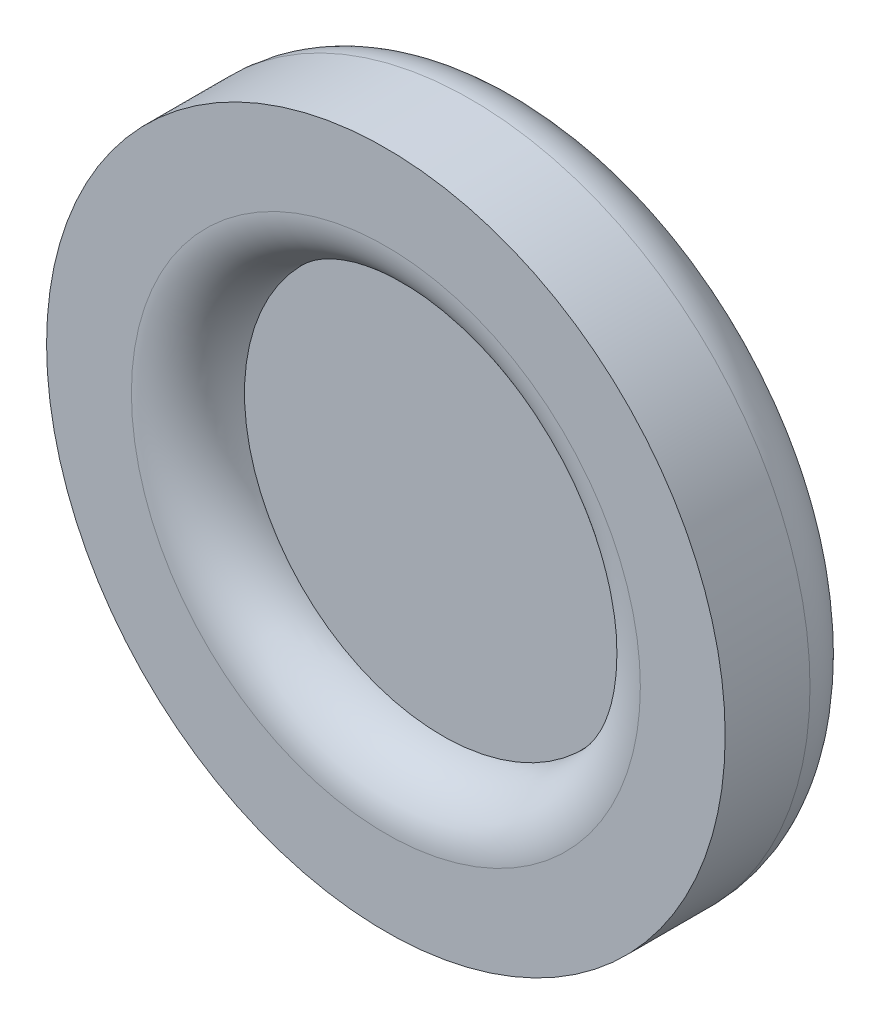
from build123d import *

# Parameters (mm, degrees)
IZIM1_R                     = 6
Y_KSEKLIK_EKSTR_ZYON1_DEPTH = 2.5
IZIM2_R                     = 3.5
KES_EKSTR_ZYON1_DEPTH       = 1
RADYUS1_R                   = 1
KES_EKSTR_ZYON2_DEPTH       = 0.75


with BuildPart() as part:
    # Çizim1 → Yükseklik-Ekstrüzyon1 (new body)
    with BuildSketch(Plane.XY):
        Circle(IZIM1_R)
    extrude(amount=Y_KSEKLIK_EKSTR_ZYON1_DEPTH)

    # Çizim2 → Kes-Ekstrüzyon1 (cut)
    with BuildSketch(Plane.XY.offset(2.5)):
        Circle(IZIM2_R)
    extrude(amount=-KES_EKSTR_ZYON1_DEPTH, mode=Mode.SUBTRACT)

    # Radyus1
    radyus1_edges = [part.edges().sort_by_distance(p)[0] for p in [
        (-6, 0, 0),
        (-3.5, 0, 2.5),
    ]]
    fillet(radyus1_edges, radius=RADYUS1_R - 0.0001)  # a hair under: the kernel refuses the full size

    # Çizim3 → Kes-Ekstrüzyon2 (cut)
    # profile 1 of 2: a face of its own
    with BuildSketch(Plane(origin=(0, 0, 0), x_dir=(-1, 0, 0), z_dir=(0, 0, -1))):
        with BuildLine():
            Line((-0.929795565, 1.3003359), (-0.683801975, 1.724214105))
            Line((-0.683801975, 1.724214105), (-0.47867377, 1.724214105))
            Line((-0.47867377, 1.724214105), (-0.47867377, 0.237034617))
            Line((-0.47867377, 0.237034617), (-0.735084027, 0.237034617))
            add(Edge.make_bspline(
                [(-0.735084027, 0.237034617), (-0.75064047, 0.286868347), (-0.781084267, 0.384392431), (-0.83356691, 0.524628794), (-0.892501203, 0.654530813), (-0.954686735, 0.775310751), (-1.022125573, 0.886178457), (-1.094152837, 0.987888941), (-1.172125049, 1.079103644), (-1.253846206, 1.16142683), (-1.339674566, 1.233044675), (-1.426952438, 1.296443905), (-1.51753898, 1.348502365), (-1.609775187, 1.392281334), (-1.704584729, 1.425953753), (-1.801421863, 1.450148778), (-1.900483194, 1.465087994), (-1.967404279, 1.466894158), (-2.001109668, 1.467803848)],
                knots=[0, 0, 0, 0, 1.319776028, 2.582787814, 3.782699321, 4.924401408, 6.015368239, 7.061002147, 8.071798736, 9.045905284, 9.99008261, 10.895199989, 11.76966991, 12.627609111, 13.473423528, 14.308713002, 15.148168534, 16, 16, 16, 16], degree=3))
            add(Edge.make_bspline(
                [(-2.001109668, 1.467803848), (-2.029438448, 1.467117142), (-2.084900049, 1.46577272), (-2.166265483, 1.457332437), (-2.243343375, 1.440936769), (-2.316505964, 1.419302589), (-2.386196292, 1.392385603), (-2.450967361, 1.35737242), (-2.512504436, 1.317374775), (-2.568686299, 1.270942394), (-2.620189553, 1.220979622), (-2.663919755, 1.166902177), (-2.702320752, 1.111626606), (-2.732919314, 1.053133641), (-2.757251849, 0.992259792), (-2.773647614, 0.92866675), (-2.784878637, 0.862966203), (-2.785864254, 0.818280035), (-2.786366078, 0.795528207)],
                knots=[0, 0, 0, 0, 1.179059863, 2.308343204, 3.398322431, 4.453397569, 5.481306975, 6.500646799, 7.511833234, 8.530869999, 9.529082904, 10.492593709, 11.420571073, 12.32549536, 13.233690467, 14.142293599, 15.054154357, 16, 16, 16, 16], degree=3))
            add(Edge.make_bspline(
                [(-2.786366078, 0.795528207), (-2.785156297, 0.768760973), (-2.782765488, 0.715862692), (-2.767697317, 0.638125981), (-2.74011211, 0.564525819), (-2.704644593, 0.493232386), (-2.655518289, 0.426495541), (-2.593191488, 0.365658888), (-2.51801856, 0.310382821), (-2.446678669, 0.267296128), (-2.379510611, 0.236501681), (-2.319729039, 0.211453404), (-2.251208769, 0.185770195), (-2.173303716, 0.161630379), (-2.087352801, 0.135792209), (-1.992626499, 0.109188541), (-1.88889226, 0.083042119), (-1.81657617, 0.066241372), (-1.779154539, 0.057547438)],
                knots=[0, 0, 0, 0, 0.943059919, 1.863705786, 2.77434775, 3.70417639, 4.66005306, 5.6778557, 6.75972726, 7.940743775, 8.605693911, 9.360472581, 10.223717259, 11.181721083, 12.232383809, 13.385071369, 14.64684479, 16, 16, 16, 16], degree=3))
            add(Edge.make_bspline(
                [(-1.779154539, 0.057547438), (-1.735327786, 0.047228998), (-1.650766921, 0.027320242), (-1.528934937, -0.003037612), (-1.417136907, -0.032862452), (-1.314784257, -0.060366544), (-1.222913181, -0.088874415), (-1.140388893, -0.114822493), (-1.067901847, -0.140347344), (-1.023486316, -0.158378148), (-1.002712232, -0.166811536)],
                knots=[0, 0, 0, 0, 1.335747715, 2.577238166, 3.724662844, 4.768505699, 5.721015054, 6.578035404, 7.334917034, 8, 8, 8, 8], degree=3))
            add(Edge.make_bspline(
                [(-1.002712232, -0.166811536), (-0.973207892, -0.18016647), (-0.9154039, -0.206331044), (-0.832285333, -0.249437538), (-0.755696501, -0.297046843), (-0.683611728, -0.346493816), (-0.618277859, -0.400171008), (-0.558166709, -0.456813452), (-0.503978604, -0.516503392), (-0.455442159, -0.579464937), (-0.412791666, -0.645779091), (-0.374916134, -0.715148419), (-0.343814011, -0.788567774), (-0.31790574, -0.865133471), (-0.298124554, -0.945306708), (-0.283445069, -1.028798756), (-0.275739149, -1.115919538), (-0.274286831, -1.175078313), (-0.273545565, -1.205273075)],
                knots=[0, 0, 0, 0, 1.14653782, 2.246261516, 3.311791084, 4.337468781, 5.33879562, 6.302025459, 7.259342286, 8.189897906, 9.113170072, 10.048231112, 10.984438999, 11.93236922, 12.907088183, 13.905150231, 14.930784337, 16, 16, 16, 16], degree=3))
            add(Edge.make_bspline(
                [(-0.273545565, -1.205273075), (-0.274415116, -1.250218566), (-0.276115481, -1.338107236), (-0.295478092, -1.46605016), (-0.324749983, -1.587301497), (-0.366538713, -1.701611901), (-0.420444766, -1.809016652), (-0.48683347, -1.908624989), (-0.564059436, -2.002372511), (-0.624321236, -2.057205807), (-0.654955821, -2.085080767)],
                knots=[0, 0, 0, 0, 1.087616632, 2.126780161, 3.126105745, 4.104252425, 5.067529187, 6.029110535, 6.998082019, 8, 8, 8, 8], degree=3))
            add(Edge.make_bspline(
                [(-0.654955821, -2.085080767), (-0.693876042, -2.116892376), (-0.771148794, -2.180051588), (-0.897431098, -2.259811493), (-1.029200924, -2.328903852), (-1.168936325, -2.383670286), (-1.314927503, -2.428652875), (-1.468646716, -2.458147081), (-1.628564666, -2.477261058), (-1.737430873, -2.479682889), (-1.792776334, -2.4809141)],
                knots=[0, 0, 0, 0, 0.978964361, 1.943649534, 2.905309704, 3.874955019, 4.86478111, 5.878630743, 6.921537144, 8, 8, 8, 8], degree=3))
            add(Edge.make_bspline(
                [(-1.792776334, -2.4809141), (-1.844386472, -2.479671831), (-1.946601067, -2.477211498), (-2.098204003, -2.457814719), (-2.246807388, -2.428299692), (-2.391275812, -2.383001538), (-2.533060343, -2.328382483), (-2.670402979, -2.25898581), (-2.805776792, -2.17970297), (-2.890800715, -2.116862592), (-2.933801975, -2.085080767)],
                knots=[0, 0, 0, 0, 1.006582518, 1.993550691, 2.977708554, 3.958494488, 4.943590011, 5.938682306, 6.957478621, 8, 8, 8, 8], degree=3))
            Line((-2.933801975, -2.085080767), (-3.247904539, -2.4809141))
            Line((-3.247904539, -2.4809141), (-3.453032744, -2.4809141))
            Line((-3.453032744, -2.4809141), (-3.453032744, -0.993734613))
            Line((-3.453032744, -0.993734613), (-3.196622488, -0.993734613))
            add(Edge.make_bspline(
                [(-3.196622488, -0.993734613), (-3.1819724, -1.043599174), (-3.15336061, -1.140985235), (-3.101798385, -1.280604958), (-3.045079626, -1.410783267), (-2.982593113, -1.53135924), (-2.914450396, -1.642342487), (-2.840687319, -1.743804949), (-2.761113742, -1.835254348), (-2.676744466, -1.918025429), (-2.585871651, -1.989909752), (-2.489941241, -2.053314555), (-2.387935479, -2.105919038), (-2.280722336, -2.149573323), (-2.168001717, -2.183238098), (-2.049735827, -2.207101016), (-1.925897299, -2.221881291), (-1.841429287, -2.223618554), (-1.798385309, -2.224503844)],
                knots=[0, 0, 0, 0, 1.231685107, 2.405495193, 3.525354633, 4.595781342, 5.62194636, 6.609716111, 7.565664147, 8.492486262, 9.407117973, 10.307971796, 11.214149599, 12.122977695, 13.04839309, 13.998283572, 14.979947126, 16, 16, 16, 16], degree=3))
            add(Edge.make_bspline(
                [(-1.798385309, -2.224503844), (-1.763372048, -2.223930766), (-1.695343044, -2.222817305), (-1.596263669, -2.212986852), (-1.503254564, -2.197268311), (-1.416089023, -2.174833264), (-1.335185617, -2.145952045), (-1.259657008, -2.111571295), (-1.190611545, -2.069816182), (-1.128119439, -2.021531266), (-1.072214084, -1.968752484), (-1.022884725, -1.91273511), (-0.981730673, -1.852873358), (-0.948116045, -1.790189392), (-0.92086714, -1.724633812), (-0.903037353, -1.65553665), (-0.891218357, -1.583346737), (-0.889703972, -1.534114637), (-0.88893018, -1.508958972)],
                knots=[0, 0, 0, 0, 1.293831505, 2.513849511, 3.675894659, 4.777316931, 5.835830258, 6.847310371, 7.83943162, 8.810906231, 9.760670304, 10.677276707, 11.564492177, 12.439039997, 13.302485202, 14.181312827, 15.070722477, 16, 16, 16, 16], degree=3))
            add(Edge.make_bspline(
                [(-0.88893018, -1.508958972), (-0.890061622, -1.474668908), (-0.892255393, -1.4081833), (-0.911933601, -1.313172535), (-0.94305116, -1.226169649), (-0.988819922, -1.148306733), (-1.047880147, -1.077942096), (-1.120947186, -1.015503712), (-1.20763373, -0.959416291), (-1.272554358, -0.930357572), (-1.306398129, -0.915208972)],
                knots=[0, 0, 0, 0, 1.057749482, 2.050889025, 2.982426971, 3.899058759, 4.824111711, 5.806369846, 6.856438707, 8, 8, 8, 8], degree=3))
            add(Edge.make_bspline(
                [(-1.306398129, -0.915208972), (-1.317855858, -0.910859447), (-1.344318245, -0.900813928), (-1.389770044, -0.885895641), (-1.4461397, -0.869049732), (-1.513501131, -0.850756035), (-1.591798588, -0.830844471), (-1.68087539, -0.809487453), (-1.780345358, -0.785058225), (-1.850444546, -0.769006984), (-1.887327616, -0.760561536)],
                knots=[0, 0, 0, 0, 0.488899624, 1.129146184, 1.907908525, 2.835958675, 3.913689345, 5.130992951, 6.490456269, 8, 8, 8, 8], degree=3))
            add(Edge.make_bspline(
                [(-1.887327616, -0.760561536), (-1.937577138, -0.748421285), (-2.035055748, -0.724870518), (-2.176238445, -0.688220243), (-2.307352437, -0.650586642), (-2.428407197, -0.61301422), (-2.539470733, -0.575541809), (-2.640154645, -0.537129153), (-2.731273565, -0.498872604), (-2.836797621, -0.447683286), (-2.954171693, -0.379733554), (-3.076772446, -0.287830068), (-3.179277761, -0.186519246), (-3.263300135, -0.076410402), (-3.325145902, 0.046531837), (-3.370609045, 0.180123447), (-3.397039027, 0.326544329), (-3.400146567, 0.428166539), (-3.401750693, 0.480624361)],
                knots=[0, 0, 0, 0, 1.15334182, 2.237357742, 3.253976117, 4.196366833, 5.065095743, 5.868568384, 6.600168899, 7.269119258, 8.484304555, 9.620101968, 10.677738208, 11.690769999, 12.695512897, 13.733835216, 14.830195993, 16, 16, 16, 16], degree=3))
            add(Edge.make_bspline(
                [(-3.401750693, 0.480624361), (-3.400818168, 0.525563639), (-3.398995437, 0.613402711), (-3.380460416, 0.741848655), (-3.352228225, 0.864218637), (-3.310881444, 0.980099068), (-3.258796972, 1.089998385), (-3.194074858, 1.192881083), (-3.118333466, 1.289786721), (-3.031130471, 1.379056434), (-2.934294565, 1.460001045), (-2.828703209, 1.530804322), (-2.715264417, 1.591236402), (-2.593557066, 1.640249228), (-2.464022919, 1.67751677), (-2.326862338, 1.705021538), (-2.18177312, 1.720909698), (-2.0823447, 1.723096913), (-2.031558385, 1.724214105)],
                knots=[0, 0, 0, 0, 1.035008797, 2.023045706, 2.98455394, 3.924884624, 4.852721898, 5.781844619, 6.720138272, 7.682138956, 8.652316847, 9.623724157, 10.606782453, 11.609229013, 12.641617044, 13.708762662, 14.829675657, 16, 16, 16, 16], degree=3))
            add(Edge.make_bspline(
                [(-2.031558385, 1.724214105), (-1.981808118, 1.723071709), (-1.882965753, 1.720802032), (-1.736821616, 1.699858651), (-1.593790532, 1.667076568), (-1.453986353, 1.620395982), (-1.317409846, 1.559863954), (-1.184106034, 1.486452185), (-1.053322157, 1.400820681), (-0.97143419, 1.334207539), (-0.929795565, 1.3003359)],
                knots=[0, 0, 0, 0, 0.989559008, 1.966026685, 2.931744359, 3.906633899, 4.894263871, 5.900484555, 6.93243245, 8, 8, 8, 8], degree=3))
        make_face()
    # profile 2 of 2: a face of its own
    with BuildSketch(Plane(origin=(0, 0, 0), x_dir=(-1, 0, 0), z_dir=(0, 0, -1))):
        with BuildLine():
            Line((0.290556999, 1.621650002), (2.61908264, 1.621650002))
            add(Edge.make_bspline(
                [(2.61908264, 1.621650002), (2.667202801, 1.620843161), (2.761292905, 1.619265531), (2.898724259, 1.603547468), (3.029188829, 1.578752313), (3.152664478, 1.545041932), (3.268270818, 1.499349008), (3.376826727, 1.444964037), (3.478551121, 1.380594481), (3.571744842, 1.306387404), (3.655234248, 1.224666434), (3.730024453, 1.139241183), (3.7915348, 1.047715594), (3.844086472, 0.952835057), (3.882789348, 0.852310645), (3.911229554, 0.747922541), (3.928485849, 0.639050914), (3.930539166, 0.56482139), (3.93158264, 0.52709872)],
                knots=[0, 0, 0, 0, 1.208406962, 2.362817014, 3.469501796, 4.542310952, 5.572738624, 6.586960962, 7.588385382, 8.591202447, 9.573403794, 10.520224877, 11.437706027, 12.338399397, 13.239242704, 14.136079127, 15.052774847, 16, 16, 16, 16], degree=3))
            add(Edge.make_bspline(
                [(3.93158264, 0.52709872), (3.93095777, 0.498497124), (3.929721947, 0.441930933), (3.9201447, 0.358202098), (3.902928968, 0.277462697), (3.880819277, 0.198918623), (3.850952714, 0.12366861), (3.814628962, 0.051093833), (3.771941112, -0.018804611), (3.723312435, -0.085910306), (3.668876238, -0.148877008), (3.609955969, -0.207781886), (3.546728964, -0.262502309), (3.478206999, -0.311896733), (3.406038195, -0.358019641), (3.328823159, -0.398903386), (3.246912537, -0.43467613), (3.133291414, -0.477095352), (2.987935822, -0.51867737), (2.813118007, -0.555713985), (2.638967017, -0.579496815), (2.523002388, -0.58215438), (2.465236486, -0.583478203)],
                knots=[0, 0, 0, 0, 0.834552119, 1.650517459, 2.454558213, 3.24145441, 4.02881367, 4.813080686, 5.607085742, 6.416210287, 7.228631585, 8.03327654, 8.845697837, 9.665710631, 10.496030122, 11.343296655, 12.212226129, 13.102564417, 14.880868407, 16.617398529, 18.315011851, 20, 20, 20, 20], degree=3))
            Line((2.465236486, -0.583478203), (1.726454435, -0.583478203))
            Line((1.726454435, -0.583478203), (1.726454435, -1.893574357))
            add(Edge.make_bspline(
                [(1.726454435, -1.893574357), (1.727232846, -1.910725651), (1.728722966, -1.94355854), (1.739717937, -1.990059721), (1.759293811, -2.030186932), (1.786036662, -2.063757303), (1.819392292, -2.089336292), (1.85691644, -2.108109753), (1.898855574, -2.119740371), (1.928300262, -2.121187637), (1.943601871, -2.121939742)],
                knots=[0, 0, 0, 0, 1.15764065, 2.216082673, 3.200007409, 4.149108222, 5.087007272, 6.014446154, 6.968161333, 8, 8, 8, 8], degree=3))
            Line((1.943601871, -2.121939742), (2.393121102, -2.121939742))
            Line((2.393121102, -2.121939742), (2.393121102, -2.378349998))
            Line((2.393121102, -2.378349998), (0.290556999, -2.378349998))
            Line((0.290556999, -2.378349998), (0.290556999, -2.121939742))
            Line((0.290556999, -2.121939742), (0.658345461, -2.121939742))
            add(Edge.make_bspline(
                [(0.658345461, -2.121939742), (0.677638879, -2.121221693), (0.713923443, -2.119871279), (0.76470485, -2.108606179), (0.808153622, -2.090173122), (0.844600238, -2.064291933), (0.871942016, -2.030341175), (0.892894847, -1.991140522), (0.903670865, -1.944872575), (0.905158379, -1.912318144), (0.905941615, -1.895176921)],
                knots=[0, 0, 0, 0, 1.209902602, 2.275428267, 3.243965672, 4.156016596, 5.048916755, 5.956179166, 6.923845715, 8, 8, 8, 8], degree=3))
            Line((0.905941615, -1.895176921), (0.905941615, 1.1440859))
            add(Edge.make_bspline(
                [(0.905941615, 1.1440859), (0.905255143, 1.160462039), (0.903940075, 1.191833701), (0.891638474, 1.236114048), (0.871329371, 1.274853183), (0.842851299, 1.306963984), (0.808801878, 1.332495411), (0.771206117, 1.352467078), (0.729098516, 1.362602212), (0.70032307, 1.364346573), (0.68558905, 1.365239746)],
                knots=[0, 0, 0, 0, 1.120276936, 2.146107126, 3.120516451, 4.093377318, 5.059846239, 6.02579504, 6.989139031, 8, 8, 8, 8], degree=3))
            Line((0.68558905, 1.365239746), (0.290556999, 1.365239746))
            Line((0.290556999, 1.365239746), (0.290556999, 1.621650002))
        make_face()
        with BuildLine():
            Line((1.726454435, -0.327067947), (2.204018538, -0.327067947))
            add(Edge.make_bspline(
                [(2.204018538, -0.327067947), (2.244688371, -0.325577356), (2.324395493, -0.322656008), (2.440478049, -0.30287069), (2.549004577, -0.267645793), (2.649504744, -0.220887497), (2.738996184, -0.163683192), (2.816326707, -0.100386207), (2.878901523, -0.03060182), (2.920687622, 0.032985739), (2.946608638, 0.089253911), (2.96300641, 0.137396476), (2.97777811, 0.191361073), (2.988135655, 0.251567139), (2.998317065, 0.317441881), (3.004410292, 0.389441874), (3.007238451, 0.467513343), (3.008072379, 0.521487662), (3.008505717, 0.549534617)],
                knots=[0, 0, 0, 0, 1.429918779, 2.802438552, 4.124023986, 5.430576424, 6.688853647, 7.849154065, 8.933184383, 9.972525568, 10.510355219, 11.10732486, 11.758826856, 12.475311058, 13.253567928, 14.102082525, 15.013775271, 16, 16, 16, 16], degree=3))
            add(Edge.make_bspline(
                [(3.008505717, 0.549534617), (3.007822047, 0.588035584), (3.006503312, 0.66230036), (2.994094697, 0.768891592), (2.975621318, 0.867121256), (2.947216598, 0.956086156), (2.91246199, 1.037426471), (2.868014817, 1.108847454), (2.816353103, 1.172192868), (2.775631056, 1.20689105), (2.755300589, 1.224214105)],
                knots=[0, 0, 0, 0, 1.237461107, 2.386947167, 3.446376381, 4.445945797, 5.384235238, 6.282770543, 7.142673841, 8, 8, 8, 8], degree=3))
            add(Edge.make_bspline(
                [(2.755300589, 1.224214105), (2.738726624, 1.235584416), (2.704205523, 1.25926708), (2.645076361, 1.287763446), (2.577825394, 1.311641986), (2.502782803, 1.331494117), (2.419409822, 1.346401044), (2.327947778, 1.357673005), (2.228138273, 1.363722887), (2.158886924, 1.364722842), (2.12308905, 1.365239746)],
                knots=[0, 0, 0, 0, 0.732467679, 1.525621067, 2.385634221, 3.333469268, 4.354097449, 5.473328018, 6.69389572, 8, 8, 8, 8], degree=3))
            add(Edge.make_bspline(
                [(2.12308905, 1.365239746), (2.102524185, 1.364992935), (2.063524878, 1.364524883), (2.007893356, 1.363545419), (1.958221138, 1.359187524), (1.914173085, 1.354313201), (1.875627805, 1.349605576), (1.843471438, 1.341021512), (1.816714902, 1.333013506), (1.790007513, 1.318964847), (1.763071431, 1.297139306), (1.742404575, 1.261339062), (1.727651472, 1.219204205), (1.726872355, 1.188043944), (1.726454435, 1.171329489)],
                knots=[0, 0, 0, 0, 1.463769306, 2.775898935, 3.95824512, 5.009908991, 5.931962772, 6.715698689, 7.376906499, 7.912524965, 8.856842093, 9.795787199, 10.817653815, 12, 12, 12, 12], degree=3))
            Line((1.726454435, 1.171329489), (1.726454435, -0.327067947))
        make_face(mode=Mode.SUBTRACT)
    extrude(amount=-KES_EKSTR_ZYON2_DEPTH, mode=Mode.SUBTRACT)


solid = part.part
